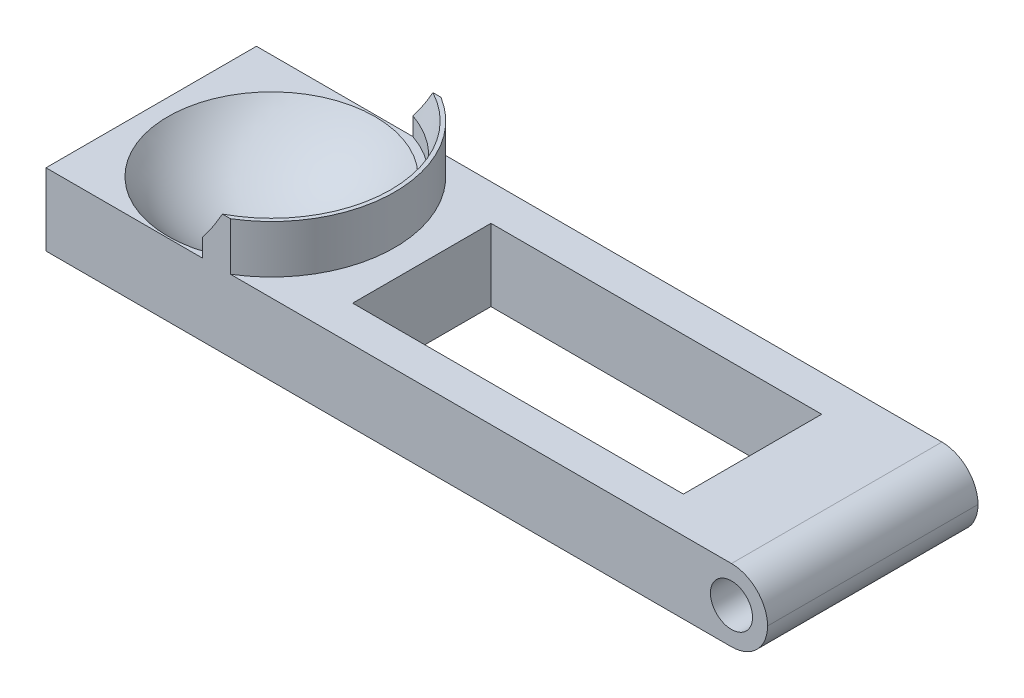
from build123d import *

# Parameters (mm, degrees)
SKETCH1_W             = 120
SKETCH1_H             = 35
BOSS_EXTRUDE1_DEPTH   = 6
FILLET1_R             = 6
F_6_0MM_DOWEL_HOLE1_D = 7
SKETCH5_R             = 5.25
CUT_EXTRUDE1_DEPTH    = 1.5
SKETCH6_W             = 55
SKETCH6_H             = 23
CUT_EXTRUDE2_DEPTH    = 64.641574462
BOSS_EXTRUDE4_DEPTH   = 8
CHAMFER1_SIZE         = 5
CHAMFER1_SIZE2        = 1.339745962


with BuildPart() as part:
    # Sketch1 → Boss-Extrude1 (new, symmetric)
    with BuildSketch(Plane(origin=(0, 0, 0), x_dir=(1, 0, 0), z_dir=(0, 1, 0))):
        Rectangle(SKETCH1_W, SKETCH1_H)
    extrude(amount=BOSS_EXTRUDE1_DEPTH, both=True)

    # Fillet1
    fillet1_edges = [part.edges().sort_by_distance(p)[0] for p in [
        (60, 6, 0),
        (60, -6, 0),
    ]]
    fillet(fillet1_edges, radius=FILLET1_R - 0.0001)  # a hair under: the kernel refuses the full size

    # Sketch2 → Cut-Revolve1 (revolve, cut)
    with BuildSketch(Plane.XY):
        with BuildLine():
            Line((-61, 18), (-19, 18))
            ThreePointArc((-19, 18), (-40, 39), (-61, 18))
        make_face()
    revolve(axis=Axis((-61, 18, 0), (1, 0, 0)), mode=Mode.SUBTRACT)

    # Ø6.0mm Dowel Hole1 (through all)
    with Locations(Plane.XY.offset(17.5)):
        with Locations((54, 0)):
            Hole(F_6_0MM_DOWEL_HOLE1_D / 2)

    # Sketch5 → Cut-Extrude1 (cut)
    with BuildSketch(Plane.XZ.offset(6)):
        with Locations(Location((-45.5, 10, 0), (0, 0, 270))):
            Circle(SKETCH5_R)
        with Locations(Location((-45.5, -10, 0), (0, 0, 90))):
            Circle(SKETCH5_R)
    extrude(amount=-CUT_EXTRUDE1_DEPTH, mode=Mode.SUBTRACT)

    # Sketch6 → Cut-Extrude2 (cut, through all)
    with BuildSketch(Plane(origin=(0, 6, 0), x_dir=(1, 0, 0), z_dir=(0, 1, 0))):
        with Locations((12.5, 0)):
            Rectangle(SKETCH6_W, SKETCH6_H)
    extrude(amount=-CUT_EXTRUDE2_DEPTH, mode=Mode.SUBTRACT)

    # Sketch8 → Boss-Extrude4 (add)
    with BuildSketch(Plane(origin=(0, 6, 0), x_dir=(1, 0, 0), z_dir=(0, 1, 0))):
        with BuildLine():
            Line((-34, 17.5), (-29.322921748, 17.5))
            ThreePointArc((-29.322921748, 17.5), (-19.5, 0), (-29.322921748, -17.5))
            Line((-29.322921748, -17.5), (-34, -17.5))
            ThreePointArc((-34, -17.5), (-21.5, 0), (-34, 17.5))
        make_face()
    extrude(amount=BOSS_EXTRUDE4_DEPTH)

    # Chamfer1
    chamfer1_edges = [part.edges().sort_by_distance(p)[0] for p in [
        (-21.5, 14, 0),
    ]]
    chamfer1_side = [part.faces().sort_by_distance(p)[0] for p in [
        (-21.5, 10, 0),
    ]]
    chamfer(chamfer1_edges, length=CHAMFER1_SIZE, length2=CHAMFER1_SIZE2, reference=chamfer1_side[0])


solid = part.part
